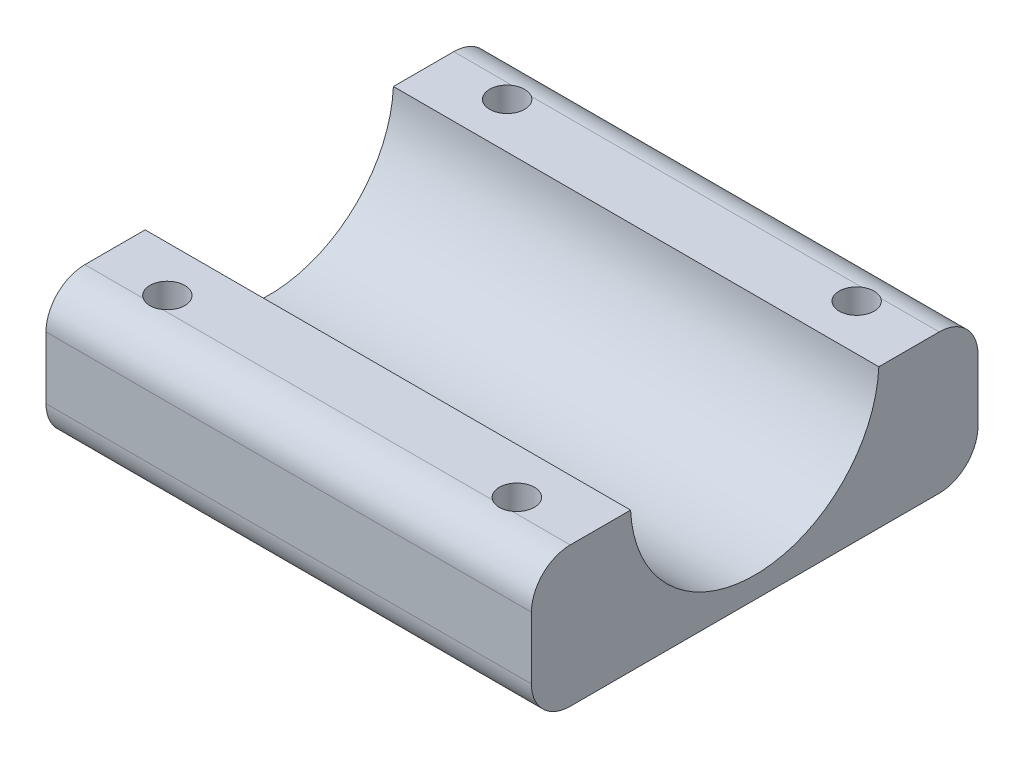
from build123d import *

# Parameters (mm, degrees)
BOSS_EXTRUDE1_DEPTH     = 25
CUT_EXTRUDE1_DEPTH      = 38.134889255
CUT_EXTRUDE1_DEPTH_BACK = 38.134889255
SKETCH2_R               = 12.8
SKETCH3_R               = 1.8
CUT_EXTRUDE2_DEPTH      = 16
SKETCH4_R               = 3.25
CUT_EXTRUDE3_DEPTH      = 5.6


with BuildPart() as part:
    # Sketch1 → Boss-Extrude1 (new, symmetric)
    with BuildSketch(Plane(origin=(0, 0, 0), x_dir=(0, 0, -1), z_dir=(1, 0, 0))):
        with BuildLine():
            Line((-19, -15), (19, -15))
            ThreePointArc((19, -15), (21.828427125, -13.828427125), (23, -11))
            Line((23, -11), (23, -4.6))
            ThreePointArc((23, -4.6), (21.828427125, -1.771572875), (19, -0.6))
            Line((19, -0.6), (-19, -0.6))
            ThreePointArc((-19, -0.6), (-21.828427125, -1.771572875), (-23, -4.6))
            Line((-23, -4.6), (-23, -11))
            ThreePointArc((-23, -11), (-21.828427125, -13.828427125), (-19, -15))
        make_face()
    extrude(amount=BOSS_EXTRUDE1_DEPTH, both=True)

    # Sketch2 → Cut-Extrude1 (cut, two sides: drawn at the far end of the back side and taken through both)
    with BuildSketch(Plane(origin=(0, 0, 0), x_dir=(0, 0, -1), z_dir=(1, 0, 0)).offset(-CUT_EXTRUDE1_DEPTH_BACK)):
        Circle(SKETCH2_R)
    extrude(amount=CUT_EXTRUDE1_DEPTH + CUT_EXTRUDE1_DEPTH_BACK, mode=Mode.SUBTRACT)

    # Sketch3 → Cut-Extrude2 (cut)
    with BuildSketch(Plane(origin=(0, -15, 0), x_dir=(1, 0, 0), z_dir=(0, 1, 0))):
        with Locations((18, -17.5)):
            Circle(SKETCH3_R)
        with Locations((18, 17.5)):
            Circle(SKETCH3_R)
        with Locations((-18, -17.5)):
            Circle(SKETCH3_R)
        with Locations((-18, 17.5)):
            Circle(SKETCH3_R)
    extrude(amount=CUT_EXTRUDE2_DEPTH, mode=Mode.SUBTRACT)

    # Sketch4 → Cut-Extrude3 (cut)
    with BuildSketch(Plane(origin=(0, -15, 0), x_dir=(1, 0, 0), z_dir=(0, 1, 0))):
        with Locations((18, -17.5)):
            Circle(SKETCH4_R)
        with Locations((18, 17.5)):
            Circle(SKETCH4_R)
        with Locations((-18, -17.5)):
            Circle(SKETCH4_R)
        with Locations((-18, 17.5)):
            Circle(SKETCH4_R)
    extrude(amount=CUT_EXTRUDE3_DEPTH, mode=Mode.SUBTRACT)


solid = part.part
